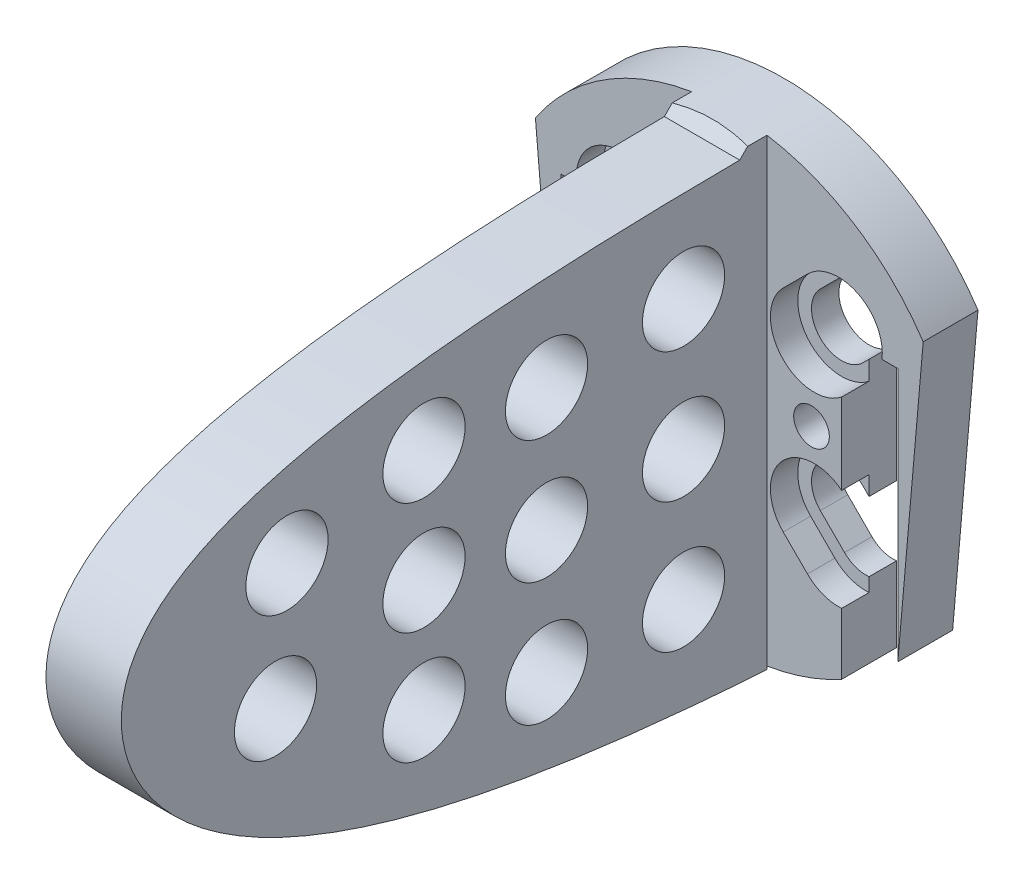
from build123d import *

# Parameters (mm, degrees)
SKETCH_2_R              = 1.3
EXTRUDE_1_DEPTH         = 4
CUT_EXTRUDE_1_DEPTH     = 2
EXTRUDE_START           = -2.75
EXTRUDE_2_DEPTH         = 5.5
CUT_EXTRUDE1_DEPTH      = 56.700937662
CUT_EXTRUDE1_DEPTH_BACK = 56.700937662
SKETCH_12_R             = 3
SKETCH1_R               = 4
CUT_EXTRUDE2_DEPTH      = 2


# Read off the part's stored shape, not the designer's step: 凸台-拉伸2
with BuildPart() as part:
    # 草图2 → 凸台-拉伸1 (new body)
    with BuildSketch(Plane.XY):
        with BuildLine():
            Line((-14.150895062, 9.420836955), (-12.3, -11.734990413))
            Line((-12.3, -11.734990413), (-12.3, 6.8))
            Line((-12.3, 6.8), (-10.126248664, 6.8))
            ThreePointArc((-10.126248664, 6.8), (-8.997025336, 9.159328805), (-6.410287771, 8.771557608))
            Line((-6.410287771, 8.771557608), (-4.642520818, 7.003790655))
            ThreePointArc((-4.642520818, 7.003790655), (-4.642520818, 3.892520818), (-7.753790655, 3.892520818))
            Line((-7.753790655, 3.892520818), (-8.2, 4.338730163))
            Line((-8.2, 4.338730163), (-8.2, -4.338730163))
            Line((-8.2, -4.338730163), (-7.753790655, -3.892520818))
            ThreePointArc((-7.753790655, -3.892520818), (-4.642520818, -3.892520818), (-4.642520818, -7.003790655))
            Line((-4.642520818, -7.003790655), (-6.410287771, -8.771557608))
            ThreePointArc((-6.410287771, -8.771557608), (-7.233498139, -9.29042366), (-8.2, -9.403434475))
            Line((-8.2, -9.403434475), (-8.2, -14.891608375))
            ThreePointArc((-8.2, -14.891608375), (0, -17), (8.2, -14.891608375))
            Line((8.2, -14.891608375), (8.2, -9.403434475))
            ThreePointArc((8.2, -9.403434475), (7.233498139, -9.29042366), (6.410287771, -8.771557608))
            Line((6.410287771, -8.771557608), (4.642520818, -7.003790655))
            ThreePointArc((4.642520818, -7.003790655), (4.642520818, -3.892520818), (7.753790655, -3.892520818))
            Line((7.753790655, -3.892520818), (8.2, -4.338730163))
            Line((8.2, -4.338730163), (8.2, 4.338730163))
            Line((8.2, 4.338730163), (7.753790655, 3.892520818))
            ThreePointArc((7.753790655, 3.892520818), (4.642520818, 3.892520818), (4.642520818, 7.003790655))
            Line((4.642520818, 7.003790655), (6.410287771, 8.771557608))
            ThreePointArc((6.410287771, 8.771557608), (8.997025336, 9.159328805), (10.126248664, 6.8))
            Line((10.126248664, 6.8), (12.3, 6.8))
            Line((12.3, 6.8), (12.3, -11.734990413))
            Line((12.3, -11.734990413), (14.150895062, 9.420836955))
            ThreePointArc((14.150895062, 9.420836955), (0, 17), (-14.150895062, 9.420836955))
        make_face()
        with Locations((-6, 0)):
            Circle(SKETCH_2_R, mode=Mode.SUBTRACT)
        with Locations((6, 0)):
            Circle(SKETCH_2_R, mode=Mode.SUBTRACT)
    extrude(amount=EXTRUDE_1_DEPTH)

    # 草图10 → 切除-拉伸1 (cut)
    with BuildSketch(Plane.XY.offset(4)):
        with BuildLine():
            Line((-5.703180989, 9.478664389), (-3.935414036, 7.710897436))
            ThreePointArc((-3.935414036, 7.710897436), (-3.935414036, 3.185414036), (-8.460897436, 3.185414036))
            Line((-8.460897436, 3.185414036), (-10.228664389, 4.953180989))
            ThreePointArc((-10.228664389, 4.953180989), (-10.228664389, 9.478664389), (-5.703180989, 9.478664389))
        make_face()
        with BuildLine():
            Line((-5.703180989, -9.478664389), (-3.935414036, -7.710897436))
            ThreePointArc((-3.935414036, -7.710897436), (-3.935414036, -3.185414036), (-8.460897436, -3.185414036))
            Line((-8.460897436, -3.185414036), (-10.228664389, -4.953180989))
            ThreePointArc((-10.228664389, -4.953180989), (-10.228664389, -9.478664389), (-5.703180989, -9.478664389))
        make_face()
        with BuildLine():
            Line((5.703180989, 9.478664389), (3.935414036, 7.710897436))
            ThreePointArc((3.935414036, 7.710897436), (3.935414036, 3.185414036), (8.460897436, 3.185414036))
            Line((8.460897436, 3.185414036), (10.228664389, 4.953180989))
            ThreePointArc((10.228664389, 4.953180989), (10.228664389, 9.478664389), (5.703180989, 9.478664389))
        make_face()
        with BuildLine():
            Line((5.703180989, -9.478664389), (3.935414036, -7.710897436))
            ThreePointArc((3.935414036, -7.710897436), (3.935414036, -3.185414036), (8.460897436, -3.185414036))
            Line((8.460897436, -3.185414036), (10.228664389, -4.953180989))
            ThreePointArc((10.228664389, -4.953180989), (10.228664389, -9.478664389), (5.703180989, -9.478664389))
        make_face()
    extrude(amount=-CUT_EXTRUDE_1_DEPTH, mode=Mode.SUBTRACT)

    # 凸台-拉伸2 outline → 凸台-拉伸2 (add)
    with BuildSketch(Plane(origin=(0, 0, 0), x_dir=(0, 0, -1), z_dir=(1, 0, 0)).offset(EXTRUDE_START)):
        with BuildLine():
            Line((-4, -17), (-4, 16.202251592))
            add(Edge.make_bspline(
                [(-4, 16.202251592), (-50.403204907, 16.202251592), (-54, 9.725618943), (-54, 4.360529693), (-54, -6.197938172), (-42.848798898, -14.485976771), (-4, -17)],
                knots=[0, 0, 0, 0, 0, 0, 0, 1, 1, 1, 1, 1, 1, 1], degree=6))
        make_face()
    extrude(amount=EXTRUDE_2_DEPTH)

    # 草图12 → Cut-Extrude1 (cut, two sides: drawn at the far end of the back side and taken through both)
    with BuildSketch(Plane(origin=(0, 0, 0), x_dir=(0, 0, -1), z_dir=(1, 0, 0)).offset(-CUT_EXTRUDE1_DEPTH_BACK)):
        with Locations((-10.089597621, 9.477228666)):
            Circle(SKETCH_12_R)
        with Locations((-10.089597621, -0.022771334)):
            Circle(SKETCH_12_R)
        with Locations((-10.089597621, -9.522771334)):
            Circle(SKETCH_12_R)
        with Locations((-20.089597621, 8.870444711)):
            Circle(SKETCH_12_R)
        with Locations((-20.089597621, -0.129555289)):
            Circle(SKETCH_12_R)
        with Locations((-20.089597621, -9.129555289)):
            Circle(SKETCH_12_R)
        with Locations((-29.034050933, 9.370090845)):
            Circle(SKETCH_12_R)
        with Locations((-29.034050933, 1.170090845)):
            Circle(SKETCH_12_R)
        with Locations((-29.034050933, -7.029909155)):
            Circle(SKETCH_12_R)
        with Locations((-39.034050933, 7.253595653)):
            Circle(SKETCH_12_R)
        with Locations((-39.868738586, -1.533288714)):
            Circle(SKETCH_12_R)
    extrude(amount=CUT_EXTRUDE1_DEPTH + CUT_EXTRUDE1_DEPTH_BACK, mode=Mode.SUBTRACT)

    # Chamfer1
    # the kernel refuses this chamfer: 2 mm, written as the material it adds along each edge
    with BuildSketch(Plane(origin=(-2.75, 16.202251592, 4), x_dir=(0, 0.9996220479086322, -0.02749111374520749), z_dir=(1, 0, 0))) as chamfer1_piece_1_section:
        with BuildLine():
            Line((2.052390471, 0), (-0.118013525, 2.043637132))
            Line((-0.118013525, 2.043637132), (-0.157992204, 2.042331311))
            ThreePointArc((-0.157992204, 2.042331311), (-0.069435245, 1.021504542), (-0.039984882, -0.001099645))
            Line((-0.039984882, -0.001099645), (0.001099645, -0.039984882))
            ThreePointArc((0.001099645, -0.039984882), (1.026519321, -0.011784294), (2.053490116, -0.039984882))
            Line((2.053490116, -0.039984882), (2.052390471, 0))
        make_face()
    chamfer1_piece_1 = extrude(amount=5.5, mode=Mode.PRIVATE)
    chamfer1_piece_1 = chamfer1_piece_1 & Plane(origin=(0, 0, 4.838799384), x_dir=(0.8324055918974517, 0.5541668797193253, 0), z_dir=(0, 0, -1)) * Cylinder(17, 20, mode=Mode.PRIVATE)
    add(chamfer1_piece_1)

    # Sketch1 → Cut-Extrude2 (cut)
    with BuildSketch(Plane(origin=(0, 0, 0), x_dir=(-1, 0, 0), z_dir=(0, 0, -1))):
        Circle(SKETCH1_R)
    extrude(amount=-CUT_EXTRUDE2_DEPTH, mode=Mode.SUBTRACT)


solid = part.part
